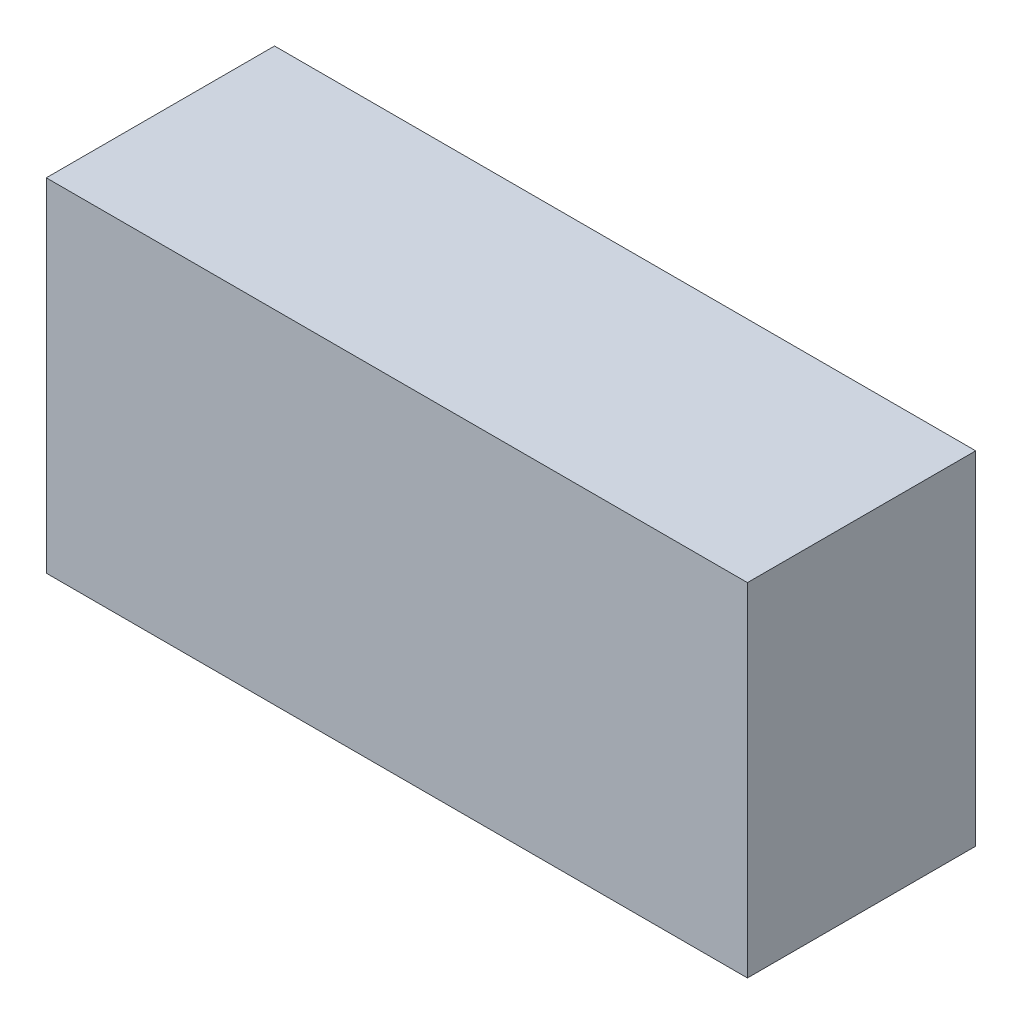
from build123d import *

# Parameters (mm, degrees)
CROQUIS1_W              = 43
CROQUIS1_H              = 21
SALIENTE_EXTRUIR1_DEPTH = 14
CROQUIS2_R              = 0.45
SALIENTE_EXTRUIR2_DEPTH = 1


with BuildPart() as part:
    # Croquis1 → Saliente-Extruir1 (new body)
    with BuildSketch(Plane.XY):
        with Locations((0, 10.5)):
            Rectangle(CROQUIS1_W, CROQUIS1_H)
    extrude(amount=SALIENTE_EXTRUIR1_DEPTH)

    # Croquis2 → Saliente-Extruir2 (add)
    with BuildSketch(Plane(origin=(0, 0, 0), x_dir=(-1, 0, 0), z_dir=(0, 0, -1))):
        with Locations((-19.5, 19)):
            Circle(CROQUIS2_R)
        with Locations((-19.5, 2)):
            Circle(CROQUIS2_R)
        with Locations((19.5, 19)):
            Circle(CROQUIS2_R)
        with Locations((19.5, 2)):
            Circle(CROQUIS2_R)
    extrude(amount=SALIENTE_EXTRUIR2_DEPTH)


solid = part.part
